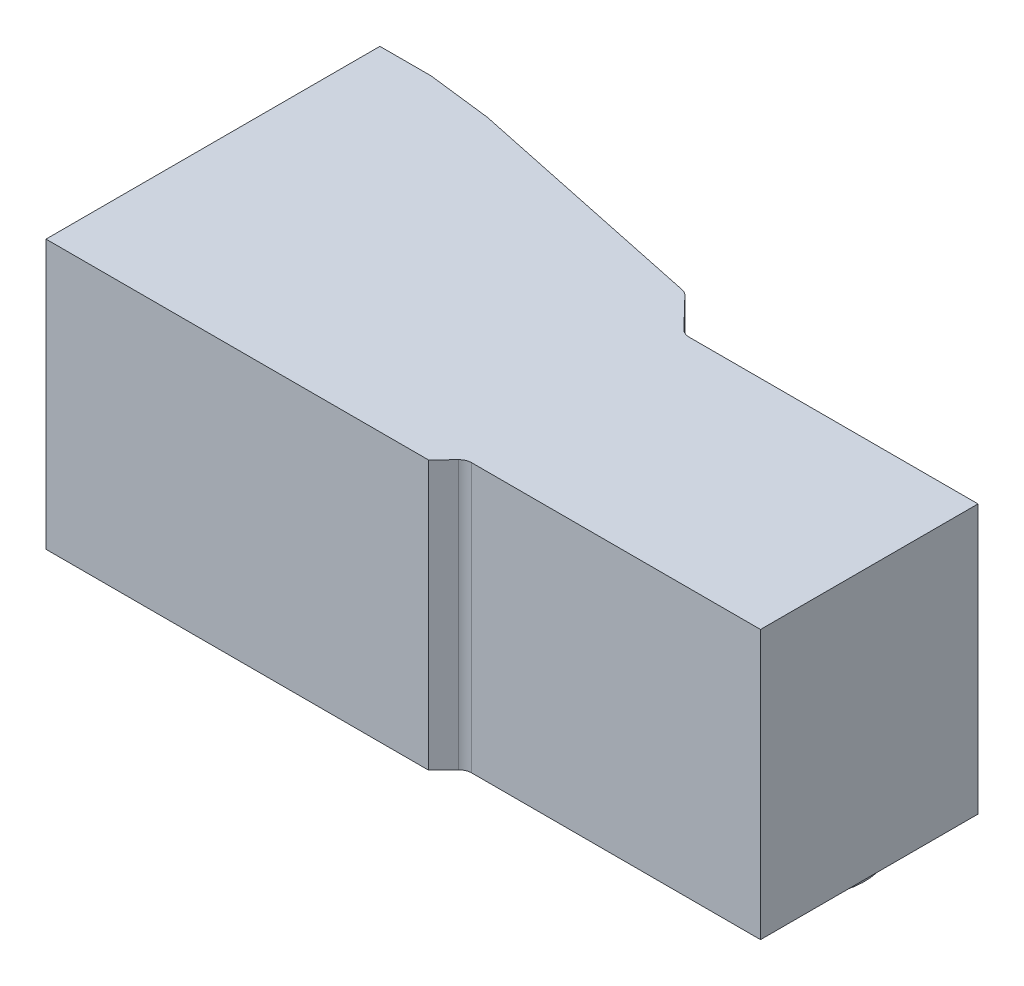
from build123d import *

# Parameters (mm, degrees)
BOSS_EXTRUDE1_DEPTH     = 210
CUT_EXTRUDE1_DEPTH      = 60
FILLET1_R               = 10
FILLET2_R               = 10
SKETCH3_R               = 50
BOSS_EXTRUDE2_DEPTH     = 5
CUT_EXTRUDE2_DEPTH      = 452.914312828
CUT_EXTRUDE2_DEPTH_BACK = 452.914312828
SKETCH4_W               = 303.312029478
SKETCH4_H               = 103.575222475


with BuildPart() as part:
    # Sketch1 → Boss-Extrude1 (new body)
    with BuildSketch(Plane(origin=(0, 0, 0), x_dir=(1, 0, 0), z_dir=(0, 1, 0))):
        Polygon((-177.169811321, 160.999367101), (-137.169811321, 160.999367101), (-87.169811321, 154.961631252), (108.540145677, 113.759535042), (136.34102955, 85), (366.34102955, 85), (366.34102955, -85), (136.34102955, -85), (108.540145677, -113.759535042), (-87.169811321, -154.961631252), (-137.169811321, -160.999367101), (-177.169811321, -160.999367101), align=None)
    extrude(amount=BOSS_EXTRUDE1_DEPTH)

    # Sketch2 → Cut-Extrude1 (cut)
    with BuildSketch(Plane.XY.offset(160)):
        Polygon((-177.169811321, 0), (366.34102955, 145), (366.34102955, 0), align=None)
    extrude(amount=-CUT_EXTRUDE1_DEPTH, mode=Mode.SUBTRACT)

    # Fillet1
    # the kernel refuses this fillet: 10 mm, written as the material it adds along each edge
    with BuildSketch(Plane(origin=(136.34102955, 0, 85), x_dir=(-0.6950220968474797, 0, 0.7189883760491075), z_dir=(0, 1, 0))) as fillet1_piece_1:
        with BuildLine():
            CenterArc((FILLET1_R * 0.424176403002, FILLET1_R), FILLET1_R, 224.028978069, 45.971021931)
            Line((-FILLET1_R * 0.294811973047, FILLET1_R * 0.304977903153), (0, 0))
            Line((0, 0), (FILLET1_R * 0.424176403002, 0))
        make_face()
    extrude(amount=210)
    # the kernel refuses this fillet: 10 mm, written as the material it takes off along each edge
    with BuildSketch(Plane(origin=(108.540145677, 68.559927222, 113.759535042), x_dir=(0.6950220968474767, 0, -0.7189883760491101), z_dir=(0, 1, 0))) as fillet1_2_piece_1:
        with BuildLine():
            CenterArc((FILLET1_R * 0.306516798333, FILLET1_R), FILLET1_R, 235.917636109, 34.082363891)
            Line((-FILLET1_R * 0.253867285946, FILLET1_R * 0.17176713535), (0, 0))
            Line((0, 0), (FILLET1_R * 0.306516798333, 0))
        make_face()
    extrude(amount=149.102992736, mode=Mode.SUBTRACT)
    with BuildSketch(Plane(origin=(-87.169811321, 22.918324442, 154.961631252), x_dir=(0.9785497849867442, 0, -0.20601048104986486), z_dir=(0, 1, 0))) as fillet1_2_piece_2:
        with BuildLine():
            CenterArc((FILLET1_R * 0.0436894476987, FILLET1_R), FILLET1_R, 264.996739811, 5.003260189)
            Line((-FILLET1_R * 0.0435229794225, FILLET1_R * 0.00381026277338), (0, 0))
            Line((0, 0), (FILLET1_R * 0.0436894476986, 0))
        make_face()
    extrude(amount=188.173911751, mode=Mode.SUBTRACT)
    with BuildSketch(Plane(origin=(-137.169811321, -1.50397119, 160.999367101), x_dir=(-1, 0, 0), z_dir=(0, 1, 0))) as fillet1_2_piece_3:
        with BuildLine():
            CenterArc((FILLET1_R * 0.0601588475808, -FILLET1_R), FILLET1_R, 90, 6.88539785)
            Line((-FILLET1_R * 0.0597249775946, -FILLET1_R * 0.00721207276614), (0, 0))
            Line((0, 0), (FILLET1_R * 0.0601588475808, 0))
        make_face()
    extrude(amount=213.007942379, mode=Mode.SUBTRACT)

    # Fillet2
    # the kernel refuses this fillet: 10 mm, written as the material it adds along each edge
    with BuildSketch(Plane(origin=(136.34102955, 0, -85), x_dir=(-0.695022096847478, 0, -0.7189883760491093), z_dir=(0, 1, 0))) as fillet2_piece_1:
        with BuildLine():
            CenterArc((FILLET2_R * 0.424176403002, -FILLET2_R), FILLET2_R, 90, 45.971021931)
            Line((-FILLET2_R * 0.294811973047, -FILLET2_R * 0.304977903153), (0, 0))
            Line((0, 0), (FILLET2_R * 0.424176403002, 0))
        make_face()
    extrude(amount=210)
    # the kernel refuses this fillet: 10 mm, written as the material it takes off along each edge
    with BuildSketch(Plane(origin=(-137.169811321, -1.50397119, -160.999367101), x_dir=(-1, 0, 0), z_dir=(0, 1, 0))) as fillet2_2_piece_1:
        with BuildLine():
            CenterArc((FILLET2_R * 0.0601588475808, FILLET2_R), FILLET2_R, 263.11460215, 6.88539785)
            Line((-FILLET2_R * 0.0597249775946, FILLET2_R * 0.00721207276614), (0, 0))
            Line((0, 0), (FILLET2_R * 0.0601588475808, 0))
        make_face()
    extrude(amount=213.007942379, mode=Mode.SUBTRACT)
    with BuildSketch(Plane(origin=(-87.169811321, -1.092236192, -154.961631252), x_dir=(-0.9927879272338658, 0, -0.11988382517539375), z_dir=(0, 1, 0))) as fillet2_2_piece_2:
        with BuildLine():
            CenterArc((FILLET2_R * 0.0436894476987, FILLET2_R), FILLET2_R, 264.996739811, 5.003260189)
            Line((-FILLET2_R * 0.0435229794225, FILLET2_R * 0.00381026277338), (0, 0))
            Line((0, 0), (FILLET2_R * 0.0436894476986, 0))
        make_face()
    extrude(amount=212.184472385, mode=Mode.SUBTRACT)
    with BuildSketch(Plane(origin=(108.540145677, -7.662919958, -113.759535042), x_dir=(-0.9785497849867494, 0, -0.20601048104984027), z_dir=(0, 1, 0))) as fillet2_2_piece_3:
        with BuildLine():
            CenterArc((FILLET2_R * 0.306516798333, FILLET2_R), FILLET2_R, 235.917636109, 34.082363891)
            Line((-FILLET2_R * 0.253867285946, FILLET2_R * 0.17176713535), (0, 0))
            Line((0, 0), (FILLET2_R * 0.306516798333, 0))
        make_face()
    extrude(amount=225.325839917, mode=Mode.SUBTRACT)

    # Sketch3 → Boss-Extrude2 (add)
    with BuildSketch(Plane.XZ):
        with Locations(Location((312.605658758, 0, 0), (0, 0, 270))):
            Circle(SKETCH3_R)
    extrude(amount=BOSS_EXTRUDE2_DEPTH)

    # Sketch4 → Cut-Extrude2 (cut, two sides: drawn at the far end of the back side and taken through both)
    with BuildSketch(Plane.XZ.offset(-CUT_EXTRUDE2_DEPTH_BACK)):
        with Locations((-25.513796582, 151.787611238)):
            Rectangle(SKETCH4_W, SKETCH4_H)
    extrude(amount=CUT_EXTRUDE2_DEPTH + CUT_EXTRUDE2_DEPTH_BACK, mode=Mode.SUBTRACT)


solid = part.part
